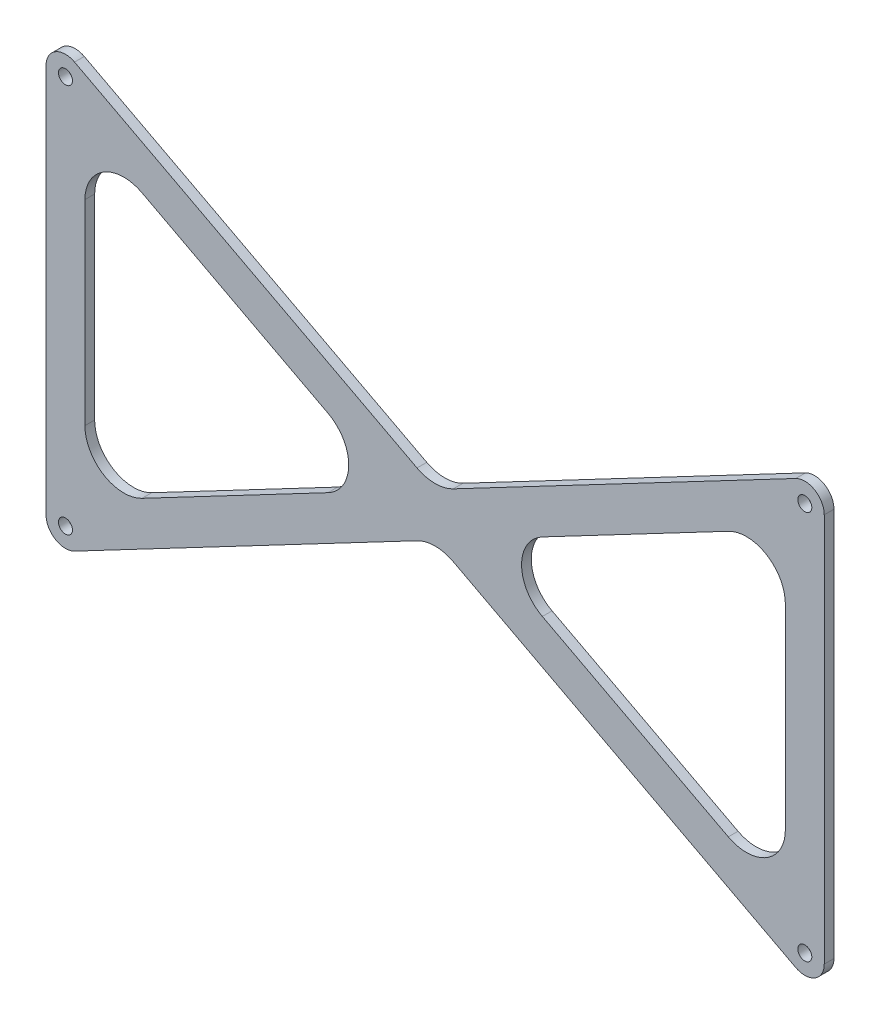
from build123d import *

# Parameters (mm, degrees)
BOSS_EXTRUDE1_DEPTH = 3.175
SKETCH2_R           = 2.286
CUT_EXTRUDE1_DEPTH  = 145.976215722
FILLET1_R           = 12.7


with BuildPart() as part:
    # Sketch1 → Boss-Extrude1 (new body)
    with BuildSketch(Plane.XY):
        with BuildLine():
            Line((-117.692510152, -69.119230712), (0, -7.175804317))
            Line((0, -7.175804317), (117.692510152, -69.119230712))
            ThreePointArc((117.692510152, -69.119230712), (123.931953645, -68.936108927), (127, -63.5))
            Line((127, -63.5), (127, 63.5))
            ThreePointArc((127, 63.5), (123.931953645, 68.936108927), (117.692510152, 69.119230712))
            Line((117.692510152, 69.119230712), (0, 7.175804317))
            Line((0, 7.175804317), (-117.692510152, 69.119230712))
            ThreePointArc((-117.692510152, 69.119230712), (-123.931953645, 68.936108927), (-127, 63.5))
            Line((-127, 63.5), (-127, -63.5))
            ThreePointArc((-127, -63.5), (-123.931953645, -68.936108927), (-117.692510152, -69.119230712))
        make_face()
        Polygon((-114.3, -52.98209042), (-13.634028202, 0), (-114.3, 52.98209042), align=None, mode=Mode.SUBTRACT)
        Polygon((13.634028202, 0), (114.3, 52.98209042), (114.3, -52.98209042), align=None, mode=Mode.SUBTRACT)
    extrude(amount=BOSS_EXTRUDE1_DEPTH)

    # Sketch2 → Cut-Extrude1 (cut, through all)
    with BuildSketch(Plane.XY.offset(3.175)):
        with Locations((-120.65, 63.5)):
            Circle(SKETCH2_R)
        with Locations((-120.65, -63.5)):
            Circle(SKETCH2_R)
        with Locations((120.65, -63.5)):
            Circle(SKETCH2_R)
        with Locations((120.65, 63.5)):
            Circle(SKETCH2_R)
    extrude(amount=-CUT_EXTRUDE1_DEPTH, mode=Mode.SUBTRACT)

    # Fillet1
    fillet1_edges = [part.edges().sort_by_distance(p)[0] for p in [
        (114.3, -52.98209042, 1.5875),
        (114.3, 52.98209042, 1.5875),
        (13.634028202, 0, 1.5875),
        (-114.3, -52.98209042, 1.5875),
        (-13.634028202, 0, 1.5875),
        (-114.3, 52.98209042, 1.5875),
        (0, 7.175804317, 1.5875),
        (0, -7.175804317, 1.5875),
    ]]
    fillet(fillet1_edges, radius=FILLET1_R)


solid = part.part
